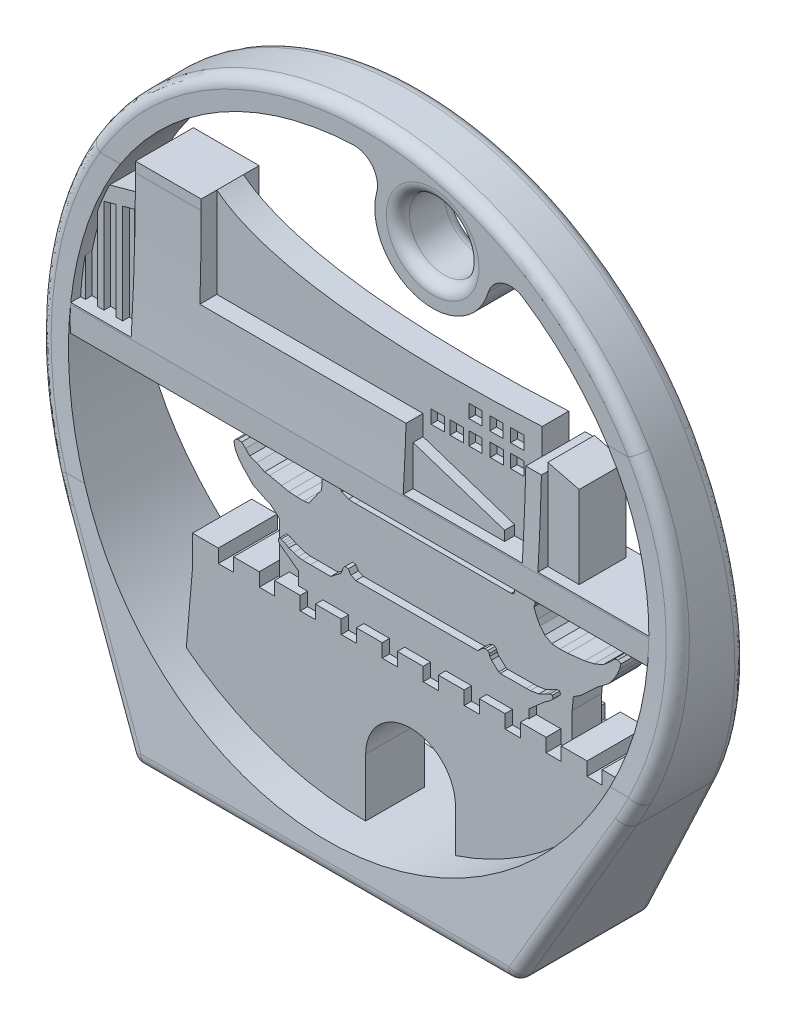
from build123d import *

# Parameters (mm, degrees)
SKETCH_3_R                = 25
EXTRUDE_2_DEPTH           = 15
CUT_EXTRUDE_1_DEPTH       = 42.683330001
CUT_EXTRUDE_1_DEPTH_BACK  = 42.683330001
EXTRUDE_3_DEPTH           = 1.5
EXTRUDE_4_DEPTH           = 2.25
EXTRUDE_5_DEPTH           = 3
SCALE_1_SCALE             = 0.85
EXTRUDE_6_DEPTH           = 1
EXTRUDE_7_DEPTH           = 1.75
SKETCH_8_4_W              = 1.172569538
SKETCH_8_4_H              = 6.185922363
EXTRUDE_8_DEPTH           = 2.5
SKETCH_8_7_W              = 48.907425182
SKETCH_8_7_H              = 2
EXTRUDE_10_DEPTH          = 2.5
CUT_EXTRUDE_10_DEPTH      = 0.5
SKETCH_10_W               = 1
SKETCH_10_H               = 1
CUT_EXTRUDE_11_DEPTH      = 0.5
SCALE_2_SCALE             = 1.15
CUT_EXTRUDE_9_DEPTH       = 45.101782337
CUT_EXTRUDE_9_DEPTH_BACK  = 45.101782337
SKETCH_7_OUTSIDE_W        = 75.231
SKETCH_7_OUTSIDE_H        = 78.822
CUT_EXTRUDE_12_DEPTH      = 40.350984879
CUT_EXTRUDE_12_DEPTH_BACK = 40.350984879
SKETCH_11_OUTSIDE_W       = 29.74
SKETCH_11_OUTSIDE_H       = 72.74
SKETCH_12_R               = 5
SKETCH_12_R_2             = 3
EXTRUDE_11_DEPTH          = 2.5
FILLET_1_R                = 1
FILLET_2_R                = 2


with BuildPart() as part:
    # 草图3 → 凸台-拉伸2 (new body)
    with BuildSketch(Plane.XY):
        with BuildLine():
            Line((-16.5, -27.5), (16.5, -27.5))
            Line((16.5, -27.5), (24.264705882, -12.941176471))
            ThreePointArc((24.264705882, -12.941176471), (0, 27.5), (-24.264705882, -12.941176471))
            Line((-24.264705882, -12.941176471), (-16.5, -27.5))
        make_face()
        Circle(SKETCH_3_R, mode=Mode.SUBTRACT)
    extrude(amount=EXTRUDE_2_DEPTH)

    # 草图4 → 切除-拉伸1 (cut, two sides: drawn at the far end of the back side and taken through both)
    with BuildSketch(Plane(origin=(0, 0, 0), x_dir=(0, 0, -1), z_dir=(1, 0, 0)).offset(-CUT_EXTRUDE_1_DEPTH_BACK)):
        with BuildLine():
            Line((-8.5, 13.504720702), (-8.5, 27.5))
            Line((-8.5, 27.5), (-29.438846662, 38.157759797))
            Line((-29.438846662, 38.157759797), (-28.663628828, -43.584654012))
            Line((-28.663628828, -43.584654012), (-12, -27.5))
            Line((-12, -27.5), (-9.944330564, -10.487905977))
            ThreePointArc((-9.944330564, -10.487905977), (-8.861409183, 1.48669023), (-8.5, 13.504720702))
        make_face()
        with BuildLine():
            Line((16.515202207, 37.178843126), (-3.5, 27.5))
            Line((-3.5, 27.5), (-3.5, 13.504720702))
            ThreePointArc((-3.5, 13.504720702), (-3.138590817, 1.48669023), (-2.055669436, -10.487905977))
            Line((-2.055669436, -10.487905977), (0, -27.5))
            Line((0, -27.5), (20.186701073, -41.47405307))
            Line((20.186701073, -41.47405307), (16.515202207, 37.178843126))
        make_face()
    extrude(amount=CUT_EXTRUDE_1_DEPTH + CUT_EXTRUDE_1_DEPTH_BACK, mode=Mode.SUBTRACT)


with BuildPart() as part_1:
    # Move Body 1: moved
    add(part.part.moved(Location((0, 0, -6))))


with BuildPart() as body_2:
    # 草图6 → 凸台-拉伸3 (new, symmetric)
    with BuildSketch(Plane.XY):
        Polygon((-69.032960394, -44.260450567), (-69.032960394, -49.68533775), (-68.065607247, -49.68533775), (-68.065607247, -48.320143487), (-66.381491705, -48.320143487), (-66.381491705, -47.009800486), (-68.227022379, -45.643974536), (-68.363348015, -45.487872758), (-68.395869288, -45.349657349), (-68.379608651, -45.170790349), (-68.314566106, -45.097617486), (-68.16009006, -45.105747804), (-67.940571469, -45.178920667), (-67.777965106, -45.260223849), (-67.582837469, -45.349657349), (-67.363318878, -45.487872758), (-66.867369469, -45.626088167), (-66.403941333, -45.788694531), (-65.964904151, -45.853737077), (-65.160002651, -45.853737077), (-63.10303215, -45.861867395), (-62.070481741, -45.065096213), (-61.964787605, -44.829316986), (-61.818441878, -44.447192031), (-61.623314241, -44.235803758), (-61.31436215, -44.292715985), (-61.04606165, -44.715492531), (-60.550112241, -44.94314144), (-48.180289236, -44.916917505), (-47.947072685, -44.751722448), (-47.733290847, -44.518505897), (-47.402900733, -44.372745553), (-47.159966826, -44.411614978), (-46.994771769, -44.586527391), (-46.936467631, -44.80030923), (-46.771272574, -45.06267785), (-46.042470852, -45.723458078), (-45.881216183, -45.787609634), (-43.203501483, -45.763413417), (-42.824427414, -45.763413417), (-41.953363596, -45.618236114), (-41.251673298, -45.263358263), (-40.824206795, -45.045592308), (-40.590310029, -45.053657714), (-40.501590566, -45.327881508), (-40.775814361, -45.62630152), (-41.033907344, -45.811805852), (-41.364588978, -46.029571806), (-42.964280017, -47.441929582), (-42.964280017, -48.320143487), (-40.472947001, -48.320143487), (-40.472947001, -49.68533775), (-39.320649119, -49.68533775), (-39.320649119, -46.139247858), (-39.198237849, -44.853369853), (-38.479866748, -44.402299627), (-37.544313687, -43.525218632), (-36.76747052, -42.806847532), (-35.614735499, -41.929766537), (-35.105193207, -41.29492696), (-34.762713961, -40.68514684), (-34.487059934, -40.050307263), (-34.378468954, -39.57417758), (-34.670829285, -39.365348772), (-35.055074293, -39.498999209), (-35.305668863, -39.791359541), (-36.182749857, -40.54314325), (-37.084890309, -40.910681953), (-38.053855979, -41.136217066), (-39.766252207, -41.328339569), (-40.576507983, -41.361752179), (-41.386763759, -41.29492696), (-42.10513486, -40.902328801), (-42.581264542, -40.32596129), (-42.831859112, -39.858184759), (-43.221831239, -38.981197478), (-43.069044539, -38.624695177), (-43.153926039, -38.370050675), (-43.578333541, -37.529723822), (-44.164015894, -37.18170967), (-44.503541895, -37.376937121), (-44.927949397, -38.022036524), (-45.174105748, -38.285169175), (-45.157129448, -38.556789976), (-45.258987249, -38.845387078), (-45.51363175, -38.921780428), (-61.331309196, -38.937541304), (-62.042036346, -38.896139723), (-62.718262178, -38.633929706), (-63.014973512, -37.985304929), (-63.442789854, -37.364281206), (-63.884406724, -37.226275934), (-64.160417268, -37.329779888), (-64.519230974, -37.812798339), (-64.733139145, -38.551126543), (-64.726238882, -38.985843149), (-64.809042045, -39.524063709), (-65.133354434, -39.938079525), (-66.057989754, -41.262930134), (-66.582409787, -41.338833033), (-67.334538518, -41.325032506), (-68.128068831, -41.276730661), (-68.852596508, -41.104224071), (-70.080843426, -40.842014055), (-70.556961614, -40.759210892), (-71.386143289, -40.368770977), (-72.081919867, -40.121511532), (-72.501685902, -39.667244179), (-72.904201278, -39.31073056), (-73.283715775, -39.281979462), (-73.461972585, -39.327981219), (-73.674730712, -39.569490445), (-73.622978735, -39.97775604), (-73.507974342, -40.328519439), (-73.197462481, -40.897791185), (-72.789196885, -41.426811394), (-72.150922503, -42.065085776), (-71.765657786, -42.49060203), (-71.000878572, -42.864366308), (-70.52361034, -43.094375094), (-69.995373348, -43.308974125), (-69.087642948, -44.085466394), align=None)
    extrude(amount=EXTRUDE_3_DEPTH, both=True)

    # 草图6<4> → 凸台-拉伸4 (add, symmetric)
    with BuildSketch(Plane.XY):
        Polygon((-66.381491705, -47.009800486), (-66.381491705, -48.320143487), (-65.446133747, -48.320143487), (-65.446133747, -49.68533775), (-63.903409456, -49.68533775), (-63.903409456, -48.320143487), (-61.283935956, -48.320143487), (-61.283935956, -49.68533775), (-59.741211665, -49.68533775), (-59.741211665, -48.320143487), (-57.121738165, -48.320143487), (-57.121738165, -49.68533775), (-55.579013874, -49.68533775), (-55.579013874, -48.320143487), (-52.959540374, -48.320143487), (-52.959540374, -49.68533775), (-51.416816083, -49.68533775), (-51.416816083, -48.320143487), (-48.797342583, -48.320143487), (-48.797342583, -49.68533775), (-47.254618292, -49.68533775), (-47.254618292, -48.320143487), (-44.635144792, -48.320143487), (-44.635144792, -49.68533775), (-43.0924205, -49.68533775), (-43.0924205, -48.320143487), (-42.964280017, -48.320143487), (-42.964280017, -47.441929582), (-41.364588978, -46.029571806), (-41.033907344, -45.811805852), (-40.775814361, -45.62630152), (-40.501590566, -45.327881508), (-40.590310029, -45.053657714), (-40.824206795, -45.045592308), (-41.251673298, -45.263358263), (-41.953363596, -45.618236114), (-42.824427414, -45.763413417), (-43.203501483, -45.763413417), (-45.881216183, -45.787609634), (-46.042470852, -45.723458078), (-46.771272574, -45.06267785), (-46.936467631, -44.80030923), (-46.994771769, -44.586527391), (-47.159966826, -44.411614978), (-47.402900733, -44.372745553), (-47.733290847, -44.518505897), (-47.947072685, -44.751722448), (-48.180289236, -44.916917505), (-60.550112241, -44.94314144), (-61.04606165, -44.715492531), (-61.31436215, -44.292715985), (-61.623314241, -44.235803758), (-61.818441878, -44.447192031), (-61.964787605, -44.829316986), (-62.070481741, -45.065096213), (-63.10303215, -45.861867395), (-65.160002651, -45.853737077), (-65.964904151, -45.853737077), (-66.403941333, -45.788694531), (-66.867369469, -45.626088167), (-67.363318878, -45.487872758), (-67.582837469, -45.349657349), (-67.777965106, -45.260223849), (-67.940571469, -45.178920667), (-68.16009006, -45.105747804), (-68.314566106, -45.097617486), (-68.379608651, -45.170790349), (-68.395869288, -45.349657349), (-68.363348015, -45.487872758), (-68.227022379, -45.643974536), align=None)
    extrude(amount=EXTRUDE_4_DEPTH, both=True)

    # 草图6<5> → 凸台-拉伸5 (add, symmetric)
    with BuildSketch(Plane.XY):
        Polygon((-73.770529329, -48.320143487), (-76.390002829, -48.320143487), (-76.390002829, -51.392298517), (-78.328226768, -73.843000781), (-30.106414948, -73.843000781), (-32.148551419, -51.392298517), (-32.148551419, -48.320143487), (-34.768024918, -48.320143487), (-34.768024918, -49.68533775), (-36.31074921, -49.68533775), (-36.31074921, -48.320143487), (-38.930222709, -48.320143487), (-38.930222709, -49.68533775), (-40.472947001, -49.68533775), (-40.472947001, -48.320143487), (-43.0924205, -48.320143487), (-43.0924205, -49.68533775), (-44.635144792, -49.68533775), (-44.635144792, -48.320143487), (-47.254618292, -48.320143487), (-47.254618292, -49.68533775), (-48.797342583, -49.68533775), (-48.797342583, -48.320143487), (-51.416816083, -48.320143487), (-51.416816083, -49.68533775), (-52.959540374, -49.68533775), (-52.959540374, -48.320143487), (-55.579013874, -48.320143487), (-55.579013874, -49.68533775), (-57.121738165, -49.68533775), (-57.121738165, -48.320143487), (-59.741211665, -48.320143487), (-59.741211665, -49.68533775), (-61.283935956, -49.68533775), (-61.283935956, -48.320143487), (-63.903409456, -48.320143487), (-63.903409456, -49.68533775), (-65.446133747, -49.68533775), (-65.446133747, -48.320143487), (-68.065607247, -48.320143487), (-68.065607247, -49.68533775), (-69.608331538, -49.68533775), (-69.608331538, -48.320143487), (-72.227805038, -48.320143487), (-72.227805038, -49.68533775), (-73.770529329, -49.68533775), align=None)
        with BuildLine():
            Line((-49.677673481, -58.954106916), (-49.677673481, -64.900007119))
            Line((-49.677673481, -64.900007119), (-58.798360665, -64.900007119))
            Line((-58.798360665, -64.900007119), (-58.798360665, -58.954106916))
            ThreePointArc((-58.798360665, -58.954106916), (-54.238017073, -54.393763324), (-49.677673481, -58.954106916))
        make_face(mode=Mode.SUBTRACT)
    extrude(amount=EXTRUDE_5_DEPTH, both=True)


with BuildPart() as body_2_1:
    # Move Body 2: moved
    add(body_2.part.moved(Location((58.303820158, 39.004910702, 0))))


with BuildPart() as body_2_2:
    # 缩放比例1: scaled about (4.075497715, -20.172374018, 0)
    add(body_2_1.part.scale(SCALE_1_SCALE).moved(Location((0.611324657, -3.025856103, 0))))


with BuildPart() as body_3:
    # 草图8 → 凸台-拉伸6 (new, symmetric)
    with BuildSketch(Plane.XY):
        with BuildLine():
            Line((-76.545419443, -52.304357929), (-76.545419443, -59.092098769))
            Line((-76.545419443, -59.092098769), (-61.05876108, -59.092098769))
            Line((-61.05876108, -59.092098769), (-61.05876108, -60.600892904))
            Line((-61.05876108, -60.600892904), (-54.18738655, -62.877453209))
            Line((-54.18738655, -62.877453209), (-54.18738655, -63.607922177))
            Line((-54.18738655, -63.607922177), (-52.115580517, -63.607922177))
            Line((-52.115580517, -63.607922177), (-52.115580517, -57.421999814))
            Line((-52.115580517, -57.421999814), (-52.115580517, -55.467717249))
            add(Edge.make_bspline(
                [(-76.545419443, -52.304357929), (-72.662372238, -55.427979956), (-62.410153557, -56.045448932), (-52.115580517, -55.467717249)],
                knots=[0, 0, 0, 0, 1, 1, 1, 1], degree=3))
        make_face()
    extrude(amount=EXTRUDE_6_DEPTH, both=True)

    # 草图8<3> → 凸台-拉伸7 (add, symmetric)
    with BuildSketch(Plane.XY):
        Polygon((-86.114380442, -55.871332814), (-86.114380442, -63.607922177), (-81.480549078, -63.607922177), (-81.480549078, -54.599306668), align=None)
        Polygon((-61.05876108, -60.600892904), (-61.05876108, -63.607922177), (-54.18738655, -63.607922177), (-54.18738655, -62.877453209), align=None)
        Polygon((-50.943010979, -63.607922177), (-48.582938497, -63.607922177), (-48.582938497, -57.421999814), (-50.943010979, -56.835715044), align=None)
    extrude(amount=EXTRUDE_7_DEPTH, both=True)


with BuildPart() as extrude_7_piece_1:
    # of the separate pieces the step leaves, piece 1, a body of its own (extrude_7_pieces)
    add(body_3.part.solids().sort_by_distance((-61.05876108, -60.600892904, -1.75))[0])



with BuildPart() as extrude_7_piece_2:
    # of the separate pieces the step leaves, piece 2, a body of its own (extrude_7_pieces)
    add(body_3.part.solids().sort_by_distance((-86.114380442, -55.871332814, -1.75))[0])

    # 草图8<4> → 凸台-拉伸8 (add, symmetric)
    with BuildSketch(Plane.XY):
        Polygon((-81.480549078, -63.607922177), (-61.05876108, -63.607922177), (-61.05876108, -59.092098769), (-76.545419443, -59.092098769), (-76.545419443, -52.304357929), (-81.480549078, -52.304357929), align=None)
        with Locations((-51.529295748, -60.514960996)):
            Rectangle(SKETCH_8_4_W, SKETCH_8_4_H)
    extrude(amount=EXTRUDE_8_DEPTH, both=True)


with BuildPart() as extrude_7_piece_3:
    # of the separate pieces the step leaves, piece 3, a body of its own (extrude_7_pieces)
    add(body_3.part.solids().sort_by_distance((-50.943010979, -63.607922177, -1.75))[0])


with BuildPart() as extrude_8_piece_1:
    # of the separate pieces the step leaves, piece 1, a body of its own (extrude_8_pieces)
    add(extrude_7_piece_2.part.solids().sort_by_distance((-81.480549078, -63.607922177, -2.5))[0])


with BuildPart() as extrude_8_piece_2:
    # of the separate pieces the step leaves, piece 2, a body of its own (extrude_8_pieces)
    add(extrude_7_piece_2.part.solids().sort_by_distance((-52.115580517, -57.421999814, -2.5))[0])


with BuildPart() as extrude_7_piece_1_1:
    add(extrude_7_piece_1.part)

    add(extrude_7_piece_3.part)  # 凸台-拉伸10 merges 凸台-拉伸7 piece 3

    add(extrude_8_piece_1.part)  # 凸台-拉伸10 merges 凸台-拉伸8 piece 1

    add(extrude_8_piece_2.part)  # 凸台-拉伸10 merges 凸台-拉伸8 piece 2
    # 草图8<7> → 凸台-拉伸10 (add, symmetric)
    with BuildSketch(Plane.XY):
        with Locations((-65.121640299, -64.607922177)):
            Rectangle(SKETCH_8_7_W, SKETCH_8_7_H)
    extrude(amount=EXTRUDE_10_DEPTH, both=True)

    # 草图9 → 切除-拉伸10 (cut)
    with BuildSketch(Plane.XY.offset(1.75)):
        Polygon((-84.770256558, -56.661434989), (-85.670256558, -56.908492649), (-85.670256558, -63.607922177), (-84.770256558, -63.607922177), align=None)
        Polygon((-83.370256558, -56.277123075), (-84.270256558, -56.524180734), (-84.270256558, -63.607922177), (-83.370256558, -63.607922177), align=None)
        Polygon((-81.970256558, -55.89281116), (-82.870256558, -56.139868819), (-82.870256558, -63.607922177), (-81.970256558, -63.607922177), align=None)
    extrude(amount=-CUT_EXTRUDE_10_DEPTH, mode=Mode.SUBTRACT)

    # 草图10 → 切除-拉伸11 (cut)
    with BuildSketch(Plane.XY.offset(1)):
        with Locations((-53.994614389, -58.891200917)):
            Rectangle(SKETCH_10_W, SKETCH_10_H)
        with Locations((-53.984729768, -57.210815362)):
            Rectangle(SKETCH_10_W, SKETCH_10_H)
        with Locations((-55.546499872, -57.220699983)):
            Rectangle(SKETCH_10_W, SKETCH_10_H)
        with Locations((-55.519747146, -58.933044988)):
            Rectangle(SKETCH_10_W, SKETCH_10_H)
        with Locations((-58.538905757, -58.990474636)):
            Rectangle(SKETCH_10_W, SKETCH_10_H)
        with Locations((-57.11957304, -58.9822704)):
            Rectangle(SKETCH_10_W, SKETCH_10_H)
        with Locations((-59.958238473, -58.990474636)):
            Rectangle(SKETCH_10_W, SKETCH_10_H)
        with Locations((-57.11957304, -57.201951328)):
            Rectangle(SKETCH_10_W, SKETCH_10_H)
    extrude(amount=-CUT_EXTRUDE_11_DEPTH, mode=Mode.SUBTRACT)


with BuildPart() as extrude_7_piece_1_2:
    # 缩放比例2: scaled about (-68.494514287, -61.032235478, -0.010808801)
    add(extrude_7_piece_1_1.part.scale(SCALE_2_SCALE).moved(Location((10.274177143, 9.154835322, 0.00162132))))


with BuildPart() as extrude_7_piece_1_3:
    # Move Body 4: moved
    add(extrude_7_piece_1_2.part.moved(Location((63.690740937, 65.363776628, 0))))


with BuildPart() as cut_extrude_9_tool:
    # 草图7 outside → 切除-拉伸9 (new, two sides: drawn at the far end of the back side and taken through both)
    with BuildSketch(Plane.XY.offset(-CUT_EXTRUDE_9_DEPTH_BACK)):
        with Locations((-0.7735, -2.569)):
            Rectangle(SKETCH_7_OUTSIDE_W, SKETCH_7_OUTSIDE_H)
        with BuildLine():
            Line((16.5, -27.5), (24.264705882, -12.941176471))
            ThreePointArc((24.264705882, -12.941176471), (24.873378691, -11.728812067), (25.421522933, -10.487905977))
            ThreePointArc((25.421522933, -10.487905977), (27.44881603, 1.677050551), (23.955636471, 13.504720702))
            ThreePointArc((23.955636471, 13.504720702), (0, 27.5), (-23.955636471, 13.504720702))
            ThreePointArc((-23.955636471, 13.504720702), (-27.44881603, 1.677050551), (-25.421522933, -10.487905977))
            ThreePointArc((-25.421522933, -10.487905977), (-24.873378691, -11.728812067), (-24.264705882, -12.941176471))
            Line((-24.264705882, -12.941176471), (-16.5, -27.5))
            Line((-16.5, -27.5), (16.5, -27.5))
        make_face(mode=Mode.SUBTRACT)
    extrude(amount=CUT_EXTRUDE_9_DEPTH + CUT_EXTRUDE_9_DEPTH_BACK)


with BuildPart() as body_2_3:
    add(body_2_2.part)

    # 切除-拉伸9: cut by cut_extrude_9_tool
    add(cut_extrude_9_tool.part, mode=Mode.SUBTRACT)


with BuildPart() as extrude_7_piece_1_4:
    add(extrude_7_piece_1_3.part)

    # 切除-拉伸9: cut by cut_extrude_9_tool
    add(cut_extrude_9_tool.part, mode=Mode.SUBTRACT)

    # 草图11 outside → 切除-拉伸12 (cut, two sides: drawn at the far end of the back side and taken through both)
    with BuildSketch(Plane(origin=(0, 0, 0), x_dir=(0, 0, -1), z_dir=(1, 0, 0)).offset(-CUT_EXTRUDE_12_DEPTH_BACK)):
        Rectangle(SKETCH_11_OUTSIDE_W, SKETCH_11_OUTSIDE_H)
        with BuildLine():
            Line((6, -27.5), (4.240773387, -12.941176471))
            Line((4.240773387, -12.941176471), (3.944330564, -10.487905977))
            ThreePointArc((3.944330564, -10.487905977), (2.861409183, 1.48669023), (2.5, 13.504720702))
            Line((2.5, 13.504720702), (2.5, 27.5))
            Line((2.5, 27.5), (-2.5, 27.5))
            Line((-2.5, 27.5), (-2.5, 13.504720702))
            ThreePointArc((-2.5, 13.504720702), (-2.861409183, 1.48669023), (-3.944330564, -10.487905977))
            Line((-3.944330564, -10.487905977), (-4.240773387, -12.941176471))
            Line((-4.240773387, -12.941176471), (-6, -27.5))
            Line((-6, -27.5), (6, -27.5))
        make_face(mode=Mode.SUBTRACT)
    extrude(amount=CUT_EXTRUDE_12_DEPTH + CUT_EXTRUDE_12_DEPTH_BACK, mode=Mode.SUBTRACT)


with BuildPart() as body_2_4:
    add(body_2_3.part)

    # Combine 2: union 凸台-拉伸7 piece 1, part
    add(extrude_7_piece_1_4.part)
    add(part_1.part)

    # 草图12 → 凸台-拉伸11 (add, symmetric)
    with BuildSketch(Plane.XY):
        with Locations((5.926536009, 21.186697971)):
            Circle(SKETCH_12_R)
        with Locations((5.926536009, 21.186697971)):
            Circle(SKETCH_12_R_2, mode=Mode.SUBTRACT)
    extrude(amount=EXTRUDE_11_DEPTH, both=True)

    # 圆角1
    fillet_1_edges = [body_2_4.edges().sort_by_distance(p)[0] for p in [
        (24.873458076, -11.728643712, 4.094256061),
        (24.873458076, -11.728643712, -4.094256061),
        (20.382352941, -20.220588235, 5.120386694),
        (20.382352941, -20.220588235, -5.120386694),
        (-16.5, -27.5, 0),
        (0, -27.5, 6),
        (16.5, -27.5, 0),
        (0, -27.5, -6),
        (2.926536009, 21.186697971, 2.5),
        (2.926536009, 21.186697971, -2.5),
    ]]
    fillet(fillet_1_edges, radius=FILLET_1_R)

    # 圆角2
    fillet_2_edges = [body_2_4.edges().sort_by_distance(p)[0] for p in [
        (10.728162271, 22.581110121, 0),
        (2.545319204, 24.870089468, 0),
    ]]
    fillet(fillet_2_edges, radius=FILLET_2_R)


solid = body_2_4.part
